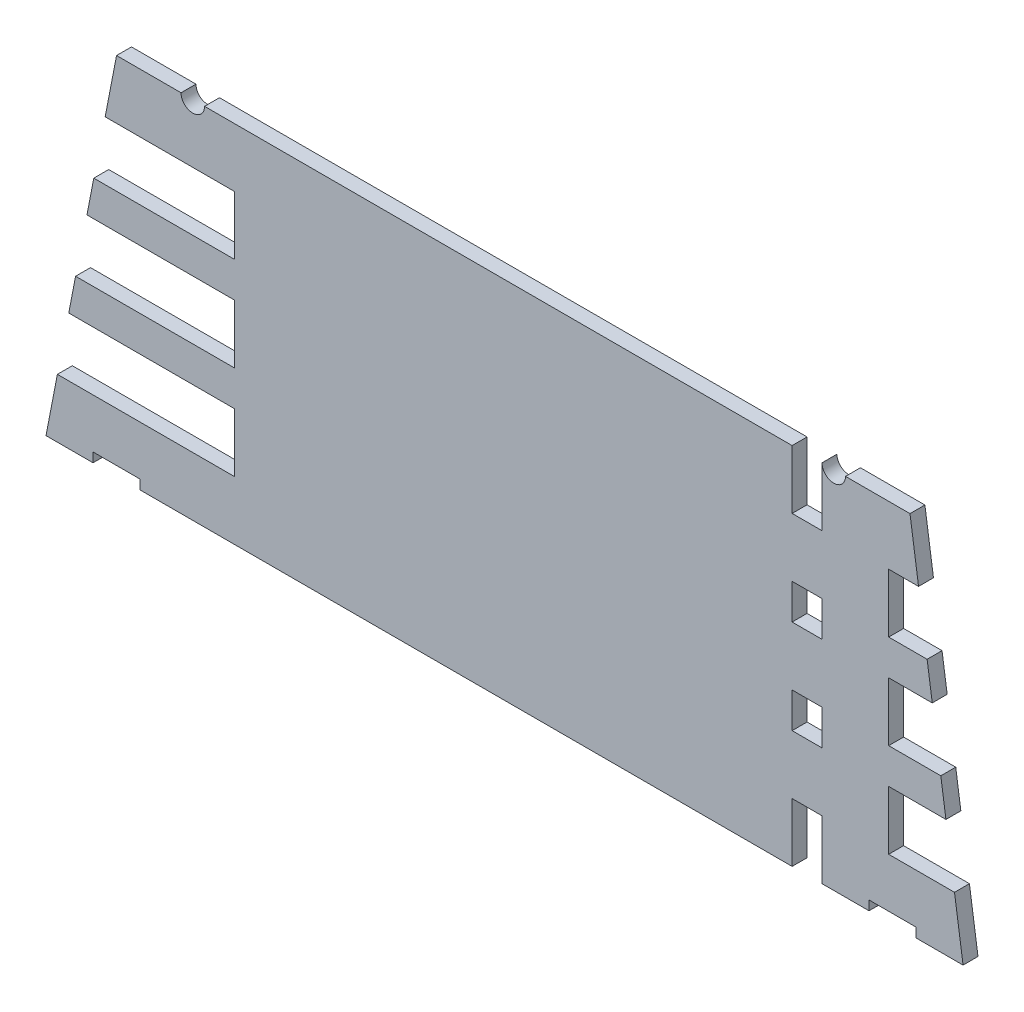
from build123d import *

# Parameters (mm, degrees)
SKETCH1_W      = 12.7
SKETCH1_H      = 15
EXTRUDE1_DEPTH = 6.35


with BuildPart() as part:
    # Sketch1 → Extrude1 (new body)
    with BuildSketch(Plane.XY):
        with BuildLine():
            Line((-152.3625, 4), (-152.3625, 0))
            Line((-152.3625, 0), (124.9375, 0))
            Line((124.9375, 0), (124.9375, 25))
            Line((124.9375, 25), (137.6375, 25))
            Line((137.6375, 25), (137.6375, 0))
            Line((137.6375, 0), (157.6375, 0))
            Line((157.6375, 0), (157.6375, 4))
            Line((157.6375, 4), (177.6375, 4))
            Line((177.6375, 4), (177.6375, 0))
            Line((177.6375, 0), (197.6375, 0))
            Line((197.6375, 0), (193.996370968, 25))
            Line((193.996370968, 25), (166.003629032, 25))
            Line((166.003629032, 25), (166.003629032, 50))
            Line((166.003629032, 50), (190.355241935, 50))
            Line((190.355241935, 50), (188.170564516, 65))
            Line((188.170564516, 65), (166.003629032, 65))
            Line((166.003629032, 65), (166.003629032, 90))
            Line((166.003629032, 90), (184.529435484, 90))
            Line((184.529435484, 90), (182.344758065, 105))
            Line((182.344758065, 105), (166.003629032, 105))
            Line((166.003629032, 105), (166.003629032, 130))
            Line((166.003629032, 130), (178.703629032, 130))
            Line((178.703629032, 130), (175.0625, 155))
            Line((175.0625, 155), (147.6375, 155))
            ThreePointArc((147.6375, 155), (142.6375, 150), (137.6375, 155))
            Line((137.6375, 155), (137.6375, 130))
            Line((137.6375, 130), (124.9375, 130))
            Line((124.9375, 130), (124.9375, 155))
            Line((124.9375, 155), (-124.9375, 155))
            ThreePointArc((-124.9375, 155), (-129.9375, 150), (-134.9375, 155))
            Line((-134.9375, 155), (-162.3625, 155))
            Line((-162.3625, 155), (-167.201209677, 130))
            Line((-167.201209677, 130), (-112.2375, 130))
            Line((-112.2375, 130), (-112.2375, 105))
            Line((-112.2375, 105), (-172.039919355, 105))
            Line((-172.039919355, 105), (-174.943145161, 90))
            Line((-174.943145161, 90), (-112.2375, 90))
            Line((-112.2375, 90), (-112.2375, 65))
            Line((-112.2375, 65), (-179.781854839, 65))
            Line((-179.781854839, 65), (-182.685080645, 50))
            Line((-182.685080645, 50), (-112.2375, 50))
            Line((-112.2375, 50), (-112.2375, 25))
            Line((-112.2375, 25), (-187.523790323, 25))
            Line((-187.523790323, 25), (-192.3625, 0))
            Line((-192.3625, 0), (-172.3625, 0))
            Line((-172.3625, 0), (-172.3625, 4))
            Line((-172.3625, 4), (-152.3625, 4))
        make_face()
        with Locations((131.2875, 57.5)):
            Rectangle(SKETCH1_W, SKETCH1_H, mode=Mode.SUBTRACT)
        with Locations((131.2875, 97.5)):
            Rectangle(SKETCH1_W, SKETCH1_H, mode=Mode.SUBTRACT)
    extrude(amount=EXTRUDE1_DEPTH)


solid = part.part
